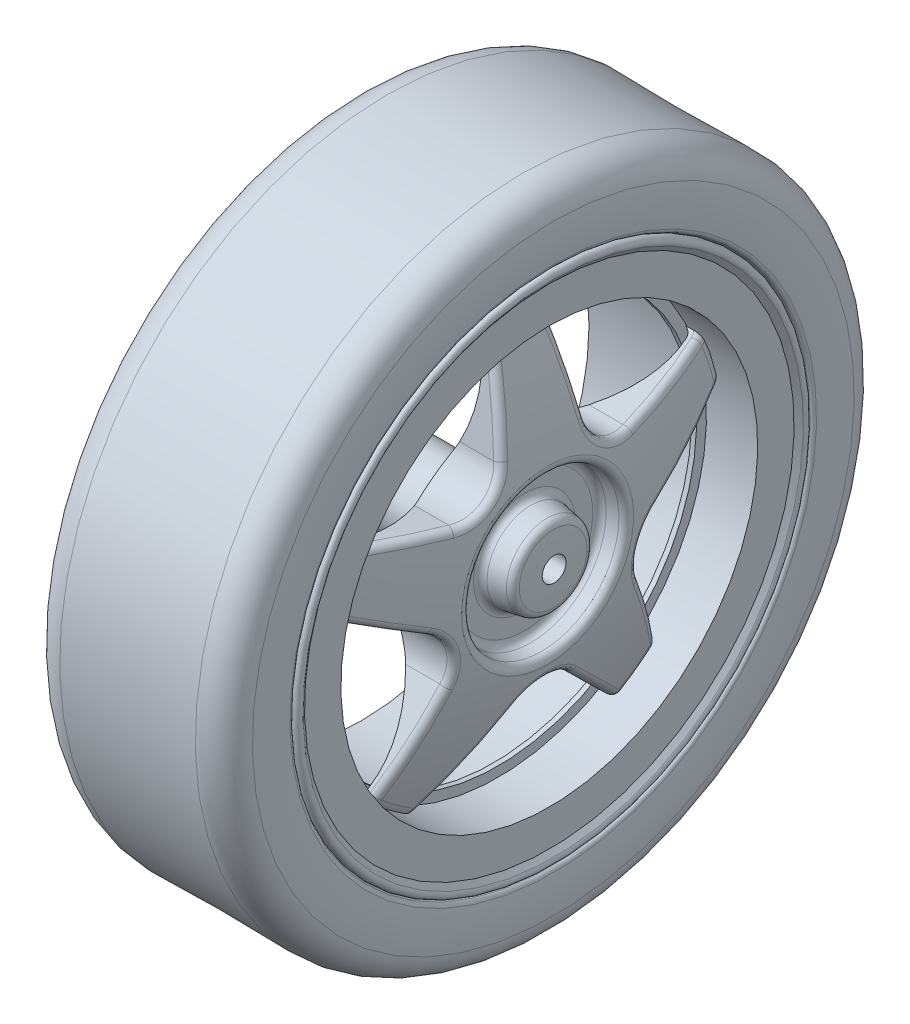
from build123d import *

# Parameters (mm, degrees)
CORTAR_EXTRUIR1_START = 28.999999999999996
CORTAR_EXTRUIR1_DEPTH = 28.999999999999996
MATRIZC1_COUNT        = 5
REDONDEO1_R           = 0.75
REDONDEO2_R           = 0.75
CORTAR_EXTRUIR2_DEPTH = 10


with BuildPart() as part:
    # Croquis1 → Revolución1 (revolve)
    with BuildSketch(Plane.XY):
        with BuildLine():
            Line((2.5, 24.999999999999996), (0.7352941176470583, 25.941176470588232))
            ThreePointArc((0.7352941176470584, 25.941176470588232), (0.12020814131487928, 25.825204772530324), (0.1003018758116564, 25.19959792024635))
            Line((0.10030187581165623, 25.19959792024635), (0.5, 24.667782059947733))
            Line((0.5, 24.667782059947733), (0.5000000000000004, 20.999999999999996))
            Line((0.5000000000000004, 20.999999999999996), (13.83221794005226, 20.999999999999996))
            Line((13.83221794005226, 20.999999999999996), (15.83221794005226, 20.999999999999996))
            Line((15.83221794005226, 20.999999999999996), (19.5, 20.999999999999996))
            Line((19.5, 20.999999999999996), (19.5, 24.667782059947736))
            Line((19.5, 24.667782059947736), (19.899698124188344, 25.19959792024635))
            ThreePointArc((19.899698124188347, 25.19959792024635), (19.879791858685124, 25.825204772530324), (19.264705882352946, 25.941176470588236))
            Line((19.264705882352946, 25.941176470588236), (17.499999999999996, 25))
            Line((17.499999999999996, 25), (2.5, 24.999999999999996))
        make_face()
    revolve(axis=Axis((20, 0, 0), (-1, -1.2e-16, 0)))


with BuildPart() as body_2:
    # Croquis1<3> → Revolución2 (revolve)
    with BuildSketch(Plane.XY):
        with BuildLine():
            ThreePointArc((15.229709414249836, 20.044993192200682), (14.678536500553854, 20.73844454625571), (13.83221794005226, 20.999999999999996))
            Line((13.83221794005226, 20.999999999999996), (15.83221794005226, 20.999999999999996))
            ThreePointArc((15.83221794005226, 20.999999999999996), (16.01691722525036, 20.715355517227323), (16.161370397048206, 20.408321987001138))
            ThreePointArc((16.161370397048206, 20.408321987001138), (18.159269913999402, 14.261864726586808), (19.437899090853012, 7.926594664305913))
            Line((19.437899090853012, 7.926594664305913), (17.000000000000004, 7.5))
            Line((17.000000000000004, 7.5), (16.999999999999996, 4.500000000000001))
            Line((16.999999999999996, 4.500000000000001), (19.857395198343077, 4))
            ThreePointArc((19.857395198343077, 4), (19.96433747853814, 2.0012706044820376), (20, 0))
            Line((20, 0), (-4.999999999999995, -3.06e-15))
            Line((-4.999999999999995, -3.06e-15), (-4.999999999999994, 4))
            Line((-4.999999999999994, 4), (7.41803141324657, 6.172963582434665))
            ThreePointArc((7.41803141324657, 6.172963582434665), (14.609153979008614, 11.25895513363789), (15.229709414249836, 20.044993192200682))
        make_face()
    revolve(axis=Axis((20, 0, 0), (-1, -1.2e-16, 0)))

    # Croquis2 → Cortar-Extruir1 (cut)
    with BuildSketch(Plane(origin=(0, 0, 0), x_dir=(0, 0, -1), z_dir=(1, 0, 0)).offset(CORTAR_EXTRUIR1_START)):
        with BuildLine():
            ThreePointArc((-19.032482471529132, 8.874942871418174), (-12.343490298141932, 16.989356881873892), (-2.5592117207636766, 20.843474647196086))
            Line((-2.5592117207636766, 20.843474647196086), (-4.238740146298038, 10.618509398268122))
            ThreePointArc((-4.238740146298038, 10.618509398268122), (-5.834705949164168, 8.030783779695161), (-8.788959816618782, 7.312581296013566))
            Line((-8.788959816618782, 7.312581296013566), (-19.032482471529132, 8.874942871418174))
        make_face()
    cortar_extruir1 = extrude(amount=-CORTAR_EXTRUIR1_DEPTH, mode=Mode.SUBTRACT)

    # MatrizC1: Cortar-Extruir1 ×5 about axis
    matrizc1_axis = Axis((0, 1.5e-15, -3.8e-16), (1, 0, 0))
    for i in range(1, MATRIZC1_COUNT):
        add(cortar_extruir1.rotate(matrizc1_axis, i * 360 / MATRIZC1_COUNT), mode=Mode.SUBTRACT)


with BuildPart() as cortar_revoluci_n1_tool:
    # Croquis3 → Cortar-Revolución1 (revolve)
    with BuildSketch(Plane.XY):
        Polygon((14.332217940052262, 19.499999999999996), (14.332217940052264, 22.499999999999993), (14.332217940052264, 22.999999999999993), (13.83221794005226, 22.999999999999993), (13.83221794005226, 20.999999999999996), (13.83221794005226, 19.499999999999996), align=None)
        Polygon((13.83221794005226, 20.999999999999996), (13.83221794005226, 22.999999999999993), (-1.1677820599477382, 22.999999999999986), (-1.1677820599477386, 20.999999999999982), align=None)
    revolve(axis=Axis((7.418031413246568, -1.54e-15, 0), (-1, -1.2e-16, 0)))


with BuildPart() as part_1:
    add(part.part)

    # Cortar-Revolución1: cut by cortar_revoluci_n1_tool
    add(cortar_revoluci_n1_tool.part, mode=Mode.SUBTRACT)

    # Croquis4 → Revolución3 (revolve)
    with BuildSketch(Plane.XY):
        with BuildLine():
            Line((14.332217940052264, 22.999999999999993), (13.832217940052262, 22.999999999999993))
            Line((13.832217940052262, 22.999999999999993), (12.332217940052265, 22.999999999999996))
            ThreePointArc((12.332217940052265, 22.999999999999996), (13.392878111832086, 22.56066017177982), (13.832217940052262, 21.499999999999996))
            Line((13.832217940052262, 21.499999999999996), (13.832217940052262, 19.999999999999996))
            Line((13.832217940052262, 19.999999999999996), (14.332217940052264, 19.999999999999996))
            Line((14.332217940052264, 19.999999999999996), (14.332217940052264, 22.999999999999993))
        make_face()
    revolve(axis=Axis((7.418031413246568, -1.54e-15, 0), (-1, -1.2e-16, 0)))


with BuildPart() as body_2_1:
    add(body_2.part)

    # Cortar-Revolución1: cut by cortar_revoluci_n1_tool
    add(cortar_revoluci_n1_tool.part, mode=Mode.SUBTRACT)

    # Redondeo1
    redondeo1_edges = [body_2_1.edges().sort_by_distance(p)[0] for p in [
        (16.017390352561375, -18.157716094822753, -9.969355513847564),
        (17.713468801645313, -14.549912860999985, -6.320010510851247),
        (19.115914274162588, -9.926594664307888, -2.471356e-11),
        (16.017390352561375, -18.157716094822757, 9.969355513847558),
        (17.713468801645313, -14.549912860999985, 6.320010510851239),
        (17.000000000000004, -7.5, -4.25e-15),
        (16.01739035256137, -15.09246337704348, 14.188313936274088),
        (17.713468801645327, -10.506857520122566, 11.884798785499381),
        (19.11591427416263, -3.067486447566317, 9.44075254010308),
        (16.017390352561375, 3.870377672372002, 20.349714489763052),
        (17.713468801645355, 1.514516838675414, 15.79078009046219),
        (16.999999999999996, -4.500000000000001, -5.5e-16),
        (19.857395198343077, -4, -4.9e-16),
        (19.11591427416269, 8.030783779682231, 5.834705949185325),
        (16.01739035256137, 20.54974104564736, 2.607459702182234),
        (17.713468801645412, 15.485935743835702, 3.4392282939293777),
        (16.01739035256137, 8.830060753846865, 18.738215769518757),
        (17.71346880164539, 8.056317798611854, 13.665220109743553),
        (16.01739035256137, 20.54974104564736, -2.607459702182232),
        (17.713468801645405, 15.485935743835707, -3.439228293929376),
        (19.11591427416269, 8.030783779711285, -5.834705949145338),
        (16.01739035256137, 8.830060753846867, -18.738215769518757),
        (17.71346880164539, 8.056317798611854, -13.665220109743546),
        (16.01739035256137, 3.870377672372008, -20.349714489763052),
        (17.713468801645355, 1.5145168386754158, -15.790780090462187),
        (19.115914274162627, -3.0674864475193098, -9.440752540118355),
        (16.017390352561375, -15.092463377043474, -14.18831393627409),
        (17.713468801645327, -10.506857520122566, -11.884798785499385),
    ]]
    fillet(redondeo1_edges, radius=REDONDEO1_R)

    # Cortar-Revolución4: read off the stored shape, not the designer's step
    # Cortar-Revolución4 outline → Cortar-Revolución4 (revolve, cut)
    with BuildSketch(Plane.YX):
        Polygon((4, -5), (6.172963582, 7.418031413), (10.776802277, 7.418031413), (10.776802277, 14.320012605), (4, 10), align=None)
    revolve(axis=Axis((0, 0, 0), (1, 0, 0)), mode=Mode.SUBTRACT)

    # Redondeo2
    redondeo2_edges = [body_2_1.edges().sort_by_distance(p)[0] for p in [
        (19.437899090853016, -7.926594664305911, -9.7e-16),
    ]]
    fillet(redondeo2_edges, radius=REDONDEO2_R)

    # Croquis8 → Cortar-Extruir2 (cut)
    with BuildSketch(Plane.ZY.offset(4.999999999999994)):
        with BuildLine():
            Line((-1.7999999999999998, 2.012461179749811), (-1.7999999999999998, -2.012461179749811))
            ThreePointArc((-1.7999999999999998, -2.012461179749811), (3.8e-16, -2.6999999999999966), (1.8000000000000003, -2.012461179749811))
            Line((1.8000000000000003, -2.012461179749811), (1.8000000000000003, 2.012461179749811))
            ThreePointArc((1.8000000000000003, 2.012461179749811), (3.8e-16, 2.6999999999999993), (-1.7999999999999998, 2.012461179749811))
        make_face()
    extrude(amount=-CORTAR_EXTRUIR2_DEPTH, mode=Mode.SUBTRACT)

    # Sketch7 → M2 Clearance Hole2 (revolve, cut)
    with BuildSketch(Plane(origin=(19.999999999999996, 0, 0), x_dir=(0, 0, -1), z_dir=(0, 1, 0))):
        Polygon((0, 0), (-6.12e-15, 24.99999999999999), (1.1999999999999962, 24.99999999999999), (1.1999999999999875, -1.41e-15), align=None)
    revolve(axis=Axis((26.349999999999987, 0, 0), (-1, 0, 0)), mode=Mode.SUBTRACT)


with BuildPart() as body_3:
    # Croquis7 → Revolución4 (revolve)
    with BuildSketch(Plane.XY):
        with BuildLine():
            Line((19.638075261313737, 26.140306806033994), (17.499999999999996, 25))
            Line((17.499999999999996, 25), (2.5, 24.999999999999996))
            Line((2.5, 24.999999999999996), (0.36192473868625213, 26.140306806033994))
            ThreePointArc((0.36192473868625213, 26.140306806033994), (0.18263537681055253, 26.30198276051036), (0.1, 26.528820112013626))
            ThreePointArc((0.1, 26.528820112013626), (7.11e-15, 28.422399549832626), (0.1, 30.315978987651633))
            ThreePointArc((0.1, 30.315978987651633), (1.1092664497680278, 32.259012986390495), (3.170041743989857, 32.998746096104654))
            ThreePointArc((3.170041743989857, 32.998746096104654), (10.000000000000023, 32.89999999999998), (16.829958256010144, 32.998746096104654))
            ThreePointArc((16.829958256010144, 32.998746096104654), (18.89073355023197, 32.25901298639051), (19.900000000000006, 30.31597898765165))
            ThreePointArc((19.900000000000006, 30.31597898765165), (20.00000000000001, 28.422399549832637), (19.899999999999995, 26.528820112013623))
            ThreePointArc((19.899999999999995, 26.528820112013623), (19.81736462318944, 26.301982760510352), (19.638075261313737, 26.140306806033994))
        make_face()
    revolve(axis=Axis((20, 0, 0), (-1, -1.2e-16, 0)))


solid = Compound([part_1.part, body_2_1.part, body_3.part])
